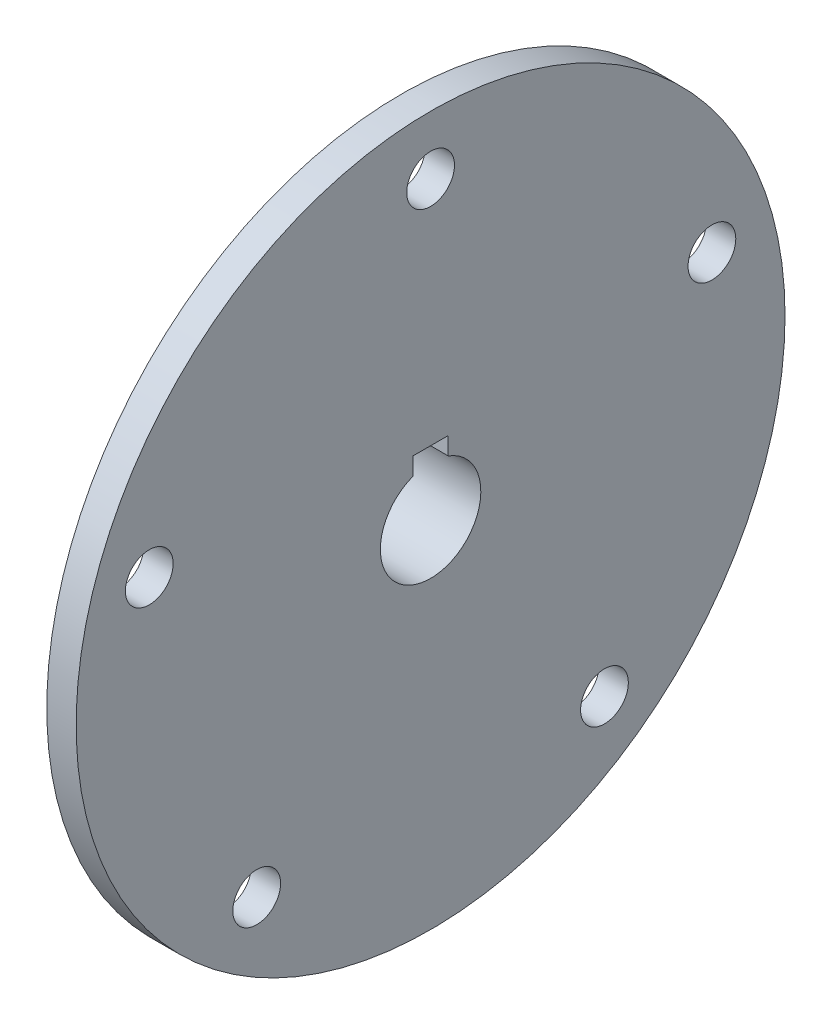
from build123d import *

# Parameters (mm, degrees)
SKETCH1_R           = 60.325
BOSS_EXTRUDE1_DEPTH = 5
SKETCH2_R           = 4.064
CUT_EXTRUDE1_DEPTH  = 86.458827806
SKETCH11_R          = 17.5
BOSS_EXTRUDE3_DEPTH = 30
CUT_EXTRUDE5_DEPTH  = 93.212858377


with BuildPart() as part:
    # Sketch1 → Boss-Extrude1 (new body)
    with BuildSketch(Plane(origin=(0, 0, 0), x_dir=(0, 0, -1), z_dir=(1, 0, 0))):
        Circle(SKETCH1_R)
    extrude(amount=-BOSS_EXTRUDE1_DEPTH)

    # Sketch2 → Cut-Extrude1 (cut, through all)
    with BuildSketch(Plane(origin=(0, 0, 0), x_dir=(0, 0, -1), z_dir=(1, 0, 0))):
        with Locations((0, 50.342959834)):
            Circle(SKETCH2_R)
        with Locations((47.879, 15.556830136)):
            Circle(SKETCH2_R)
        with Locations((29.590849347, -40.728310053)):
            Circle(SKETCH2_R)
        with Locations((-29.590849347, -40.728310053)):
            Circle(SKETCH2_R)
        with Locations((-47.879, 15.556830136)):
            Circle(SKETCH2_R)
    extrude(amount=-CUT_EXTRUDE1_DEPTH, mode=Mode.SUBTRACT)

    # Sketch11 → Boss-Extrude3 (add)
    with BuildSketch(Plane.ZY.offset(5)):
        Circle(SKETCH11_R)
    extrude(amount=BOSS_EXTRUDE3_DEPTH)

    # Sketch12 → Cut-Extrude5 (cut, through all)
    with BuildSketch(Plane.ZY.offset(35)):
        with BuildLine():
            Line((0, 11.006403687), (-3, 11.006403687))
            Line((-3, 11.006403687), (-3, 8.006403687))
            ThreePointArc((-3, 8.006403687), (0, -8.55), (3, 8.006403687))
            Line((3, 8.006403687), (3, 11.006403687))
            Line((3, 11.006403687), (0, 11.006403687))
        make_face()
    extrude(amount=-CUT_EXTRUDE5_DEPTH, mode=Mode.SUBTRACT)


solid = part.part
